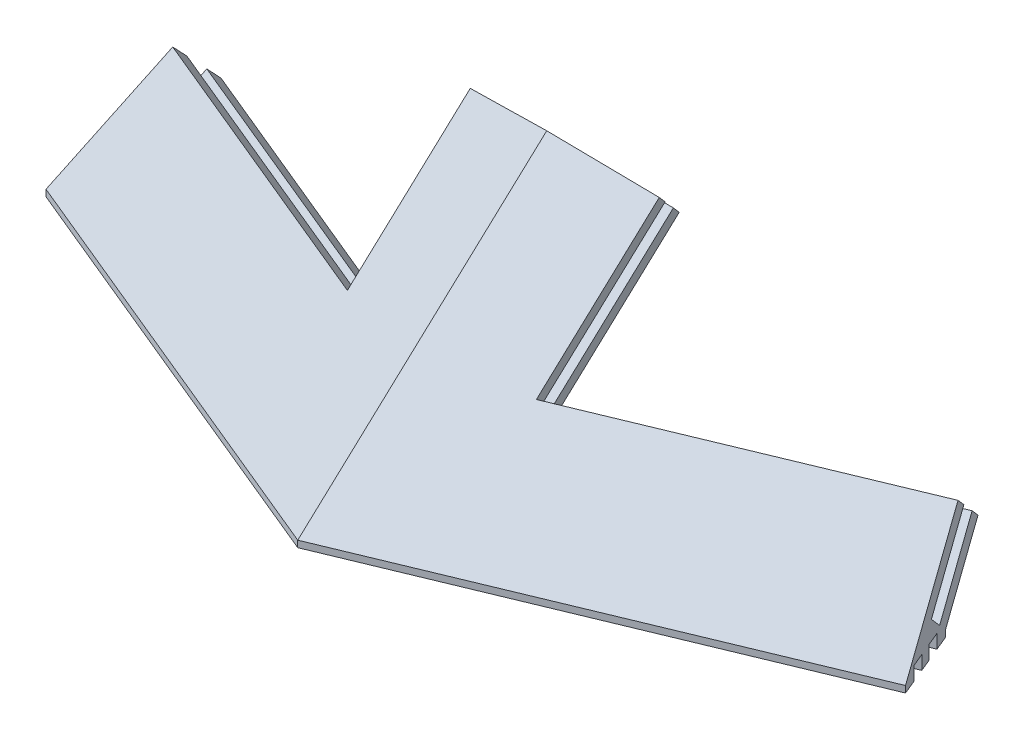
from build123d import *

# Parameters (mm, degrees)
SKETCH1_W                = 214.089522673
SKETCH1_H                = 271.033566845
BOSS_EXTRUDE1_DEPTH      = 10
SKETCH3_W                = 107.044761337
SKETCH3_H                = 271.033566845
CUT_EXTRUDE1_DEPTH       = 252.253590179
CUT_EXTRUDE2_DEPTH       = 249.55642867
BOSS_EXTRUDE3_DEPTH      = 40
CUT_EXTRUDE3_START       = -165.689856025
CUT_EXTRUDE3_DEPTH       = 205.862728092
CUT_EXTRUDE4_DEPTH       = 250.960593361
CUT_EXTRUDE5_DEPTH       = 250.960593361
BOSS_EXTRUDE5_DEPTH      = 45
CUT_EXTRUDE7_DEPTH       = 253.784190336
CUT_EXTRUDE9_DEPTH       = 253.784190336
CUT_EXTRUDE10_DEPTH      = 105
BOSS_EXTRUDE6_DEPTH      = 13.546139965
BOSS_EXTRUDE7_DEPTH      = 30
CUT_EXTRUDE12_DEPTH      = 30
SKETCH30_W               = 11.3
SKETCH30_H               = 54
CUT_EXTRUDE13_DEPTH      = 30
CUT_EXTRUDE14_DEPTH      = 30
CUT_EXTRUDE14_DEPTH_BACK = 101.665148292
SKETCH31_W               = 44.683801498
SKETCH31_H               = 21.311404518


with BuildPart() as part:
    # Sketch1 → Boss-Extrude1 (new body)
    with BuildSketch(Plane(origin=(0, 0, 0), x_dir=(1, 0, 0), z_dir=(0, 1, 0))):
        with Locations((-3.148375333, -90.062114546)):
            Rectangle(SKETCH1_W, SKETCH1_H)
    extrude(amount=BOSS_EXTRUDE1_DEPTH)

    # Sketch3 → Cut-Extrude1 (cut, through all)
    with BuildSketch(Plane(origin=(0, 10, 0), x_dir=(1, 0, 0), z_dir=(0, 1, 0))):
        with Locations((-56.670756002, -90.062114546)):
            Rectangle(SKETCH3_W, SKETCH3_H)
    extrude(amount=-CUT_EXTRUDE1_DEPTH, mode=Mode.SUBTRACT)

    # Sketch4 → Cut-Extrude2 (cut, through all)
    with BuildSketch(Plane(origin=(0, 10, 0), x_dir=(1, 0, 0), z_dir=(0, 1, 0))):
        Polygon((103.896386003, -181.239506042), (100.834918545, -173.848469781), (9.996584241, 45.454668877), (103.896386003, 45.454668877), align=None)
    extrude(amount=-CUT_EXTRUDE2_DEPTH, mode=Mode.SUBTRACT)

    # Sketch6 → Boss-Extrude3 (add, along a direction that is not the sketch's normal)
    with BuildSketch(Plane(origin=(0, 10, 0), x_dir=(1, 0, 0), z_dir=(0, 1, 0))):
        Polygon((99.572063218, -170.799667324), (103.896386003, -181.239506042), (-3.148375333, -225.578897968), (-3.148375333, -213.347866105), align=None)
    extrude(amount=BOSS_EXTRUDE3_DEPTH, dir=(-0.2705980500730979, 0.7071067811865489, -0.6532814824381872))

    # Cut-Extrude3: read off the stored shape, not the designer's step
    # Cut-Extrude3 outline → Cut-Extrude3 (cut)
    with BuildSketch(Plane(origin=(0, 0, 0), x_dir=(1, 0, 0), z_dir=(0, 0.6785983445458481, -0.7345095552677544)).offset(CUT_EXTRUDE3_START)):
        Polygon((-3.148375333, -165), (-3.148375333, -152.122604304), (-13.972297336, -155.165042499), (-15, -155.45391393), (-15, -165), align=None)
    extrude(amount=CUT_EXTRUDE3_DEPTH, mode=Mode.SUBTRACT)

    # Sketch8 → Cut-Extrude4 (cut, through all)
    with BuildSketch(Plane(origin=(0, 10, 0), x_dir=(1, 0, 0), z_dir=(0, 1, 0))):
        Polygon((-3.148375333, -225.578897968), (103.896386003, -181.239506042), (103.896386003, -225.578897968), align=None)
    extrude(amount=-CUT_EXTRUDE4_DEPTH, mode=Mode.SUBTRACT)

    # Sketch9 → Cut-Extrude5 (cut, through all)
    with BuildSketch(Plane(origin=(0, 10, 0), x_dir=(1, 0, 0), z_dir=(0, 1, 0))):
        Polygon((-3.148375333, -213.347866105), (99.572063218, -170.799667324), (9.996584241, 45.454668877), (-3.148375333, 45.454668877), align=None)
    extrude(amount=-CUT_EXTRUDE5_DEPTH, mode=Mode.SUBTRACT)

    # Sketch13 → Boss-Extrude5 (add)
    with BuildSketch(Plane.XZ):
        Polygon((-3.148375333, 225.578897968), (-3.148375333, 213.347866105), (99.572063218, 170.799667324), (103.896386003, 181.239506042), align=None)
    extrude(amount=BOSS_EXTRUDE5_DEPTH)

    # Sketch14 → Cut-Extrude7 (cut, through all)
    with BuildSketch(Plane(origin=(24.603270673, 0, -10.191008392), x_dir=(-0.38268343236508967, 0, -0.9238795325112868), z_dir=(0.9238795325112867, 0, -0.3826834323650896))):
        Polygon((-178.918624473, 38.284271247), (-173.268624473, 32.634271247), (-167.618624473, 38.284271247), align=None)
    extrude(amount=-CUT_EXTRUDE7_DEPTH, mode=Mode.SUBTRACT)

    # Sketch21 → Cut-Extrude9 (cut, through all)
    with BuildSketch(Plane(origin=(24.603270673, 0, -10.191008392), x_dir=(-0.38268343236508967, 0, -0.9238795325112868), z_dir=(0.9238795325112867, 0, -0.3826834323650896))):
        Polygon((-178.918624473, 38.284271247), (-173.268624473, 32.634271247), (-186.710507565, 19.192388155), (-188.372208501, 20.854089091), (-197.564596656, 11.661700936), (-199.891194785, 13.988299064), (-190.698806629, 23.18068722), (-192.360507565, 24.842388155), align=None)
    extrude(amount=-CUT_EXTRUDE9_DEPTH, mode=Mode.SUBTRACT)

    # Sketch26 → Cut-Extrude10 (cut)
    with BuildSketch(Plane(origin=(24.603270673, 0, -10.191008392), x_dir=(-0.38268343236508967, 0, -0.9238795325112868), z_dir=(0.9238795325112867, 0, -0.3826834323650896))):
        Polygon((-195.90289572, 9), (-195.90289572, -45), (-207.20289572, -45), (-207.20289572, 9), (-204.80289572, 9), (-204.80289572, 11.1), (-202.60289572, 11.1), (-202.60289572, 9), (-200.50289572, 9), (-200.50289572, 11.1), (-198.30289572, 11.1), (-198.30289572, 9), align=None)
    extrude(amount=-CUT_EXTRUDE10_DEPTH, mode=Mode.SUBTRACT)

    # Sketch27 → Boss-Extrude6 (add, along a direction that is not the sketch's normal)
    with BuildSketch(Plane(origin=(35.57097911, -92.95144786, 85.875940195), x_dir=(0.9626924198811571, 0.19875685341551327, -0.18362738881693624), z_dir=(-0.2705980500730966, 0.7071067811865525, -0.6532814824381838))):
        Polygon((-40.219860097, -165.940754997), (-39.260177115, -165.659670359), (-38.335322468, -168.817321636), (-40.219860097, -169.369289928), align=None)
    extrude(amount=BOSS_EXTRUDE6_DEPTH, dir=(0, 0.6785983445458494, -0.7345095552677533))

    # Sketch28 → Boss-Extrude7 (add, along a direction that is not the sketch's normal)
    with BuildSketch(Plane(origin=(32.053204459, -83.759059705, 77.383280924), x_dir=(0.9626924198811573, 0.1987568534155131, -0.18362738881693524), z_dir=(-0.27059805007309584, 0.7071067811865541, -0.6532814824381823))):
        Polygon((-23.130198055, -160.935308873), (-23.790746954, -158.680053865), (-36.565759807, -162.4217685), (-36.565759807, -170.747754034), (-21.54479451, -166.348215158), (-22.205343409, -164.09296015), (-34.681222178, -167.74706044), (-35.606076824, -164.589409163), align=None)
    extrude(amount=BOSS_EXTRUDE7_DEPTH, dir=(0, 0.6785983445458483, -0.7345095552677544))

    # Sketch29 → Cut-Extrude12 (cut)
    with BuildSketch(Plane(origin=(41.559974827, 108.60144786, 100.334654879), x_dir=(0.9626924198811563, -0.1987568534155138, -0.18362738881693985), z_dir=(0.2705980500730995, 0.7071067811865461, 0.6532814824381895))):
        Polygon((-46.440949609, -107.03174708), (-31.419984312, -107.03174708), (-31.419984312, -102.632208204), align=None)
    extrude(amount=-CUT_EXTRUDE12_DEPTH, mode=Mode.SUBTRACT)

    # Sketch30 → Cut-Extrude13 (cut)
    with BuildSketch(Plane(origin=(-72.40408024, 0, 29.990752007), x_dir=(-0.3826834323650857, 0, -0.9238795325112884), z_dir=(0.9238795325112884, 0, -0.3826834323650857))):
        with Locations((-201.55289572, -18)):
            Rectangle(SKETCH30_W, SKETCH30_H)
    extrude(amount=-CUT_EXTRUDE13_DEPTH, mode=Mode.SUBTRACT)

    # Sketch31 → Cut-Extrude14 (cut, two sides: drawn at the far end of the back side and taken through both)
    with BuildSketch(Plane(origin=(74.968792545, 0, 180.990675716), x_dir=(-0.9238795325112865, 0, 0.38268343236509056), z_dir=(-0.38268343236509056, 0, -0.9238795325112865)).offset(-CUT_EXTRUDE14_DEPTH_BACK)):
        with Locations((-4.288487529, 19.655702259)):
            Rectangle(SKETCH31_W, SKETCH31_H)
    extrude(amount=CUT_EXTRUDE14_DEPTH + CUT_EXTRUDE14_DEPTH_BACK, mode=Mode.SUBTRACT)

    # Mirror4: part across plane


with BuildPart() as part_1:
    add(part.part)
    add(part.part.mirror(Plane(origin=(-3.148375333, 0, 225.578897968), x_dir=(0, 0, 1), z_dir=(1, 0, 0))))


solid = part_1.part
